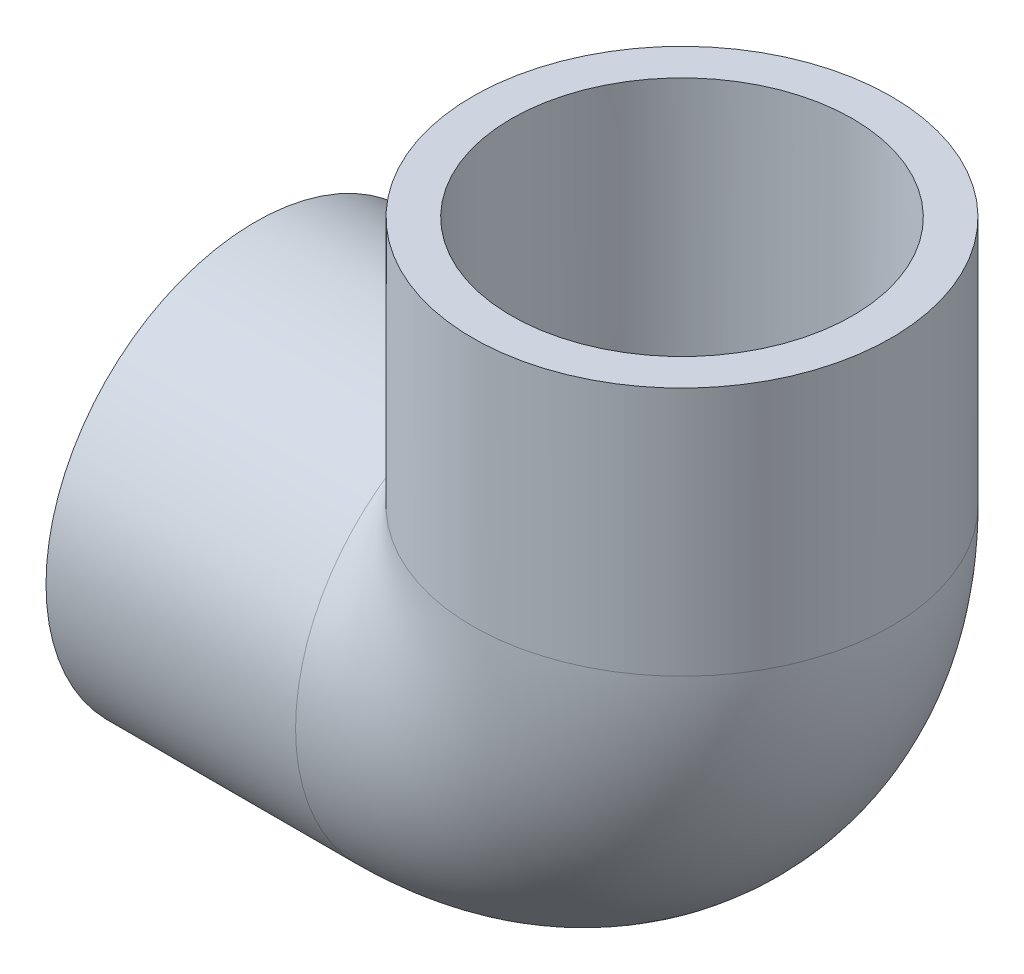
from build123d import *

# Parameters (mm, degrees)
SKETCH3_R   = 20.6375
SKETCH3_R_2 = 13.3223


with BuildPart() as part:
    # Sketch1 → Revolve1 (revolve)
    with BuildSketch(Plane.XY):
        Polygon((-42.06875, -20.6375), (-17.4625, -20.6375), (-17.4625, -16.637), (-42.06875, -16.8275), align=None)
    revolve(axis=Axis((-42.06875, 0, 0), (1, 0, 0)))


with BuildPart() as body_2:
    # Sketch2 → Revolve2 (revolve)
    with BuildSketch(Plane.XY):
        Polygon((16.8275, 42.06875), (16.637, 17.4625), (20.6375, 17.4625), (20.6375, 42.06875), align=None)
    revolve(axis=Axis((0, 0, 0), (0, 1, 0)))


with BuildPart() as sweep1_tool:
    # Sweep1: sweep along a path in Sketch4
    with BuildLine(Plane.XY) as sweep1_path:
        ThreePointArc((-17.4625, 0), (-5.114648, 5.114648), (0, 17.4625))
    # Sketch3 → Sweep1 (sweep)
    with BuildSketch(Plane(origin=(-17.4625, 0, 0), x_dir=(0, 0, -1), z_dir=(1, 0, 0))):
        Circle(SKETCH3_R)
        Circle(SKETCH3_R_2, mode=Mode.SUBTRACT)
    sweep(path=sweep1_path.line)


with BuildPart() as part_1:
    add(part.part)


with BuildPart() as part_2:
    # Sweep1: joined with sweep1_tool
    add(part_1.part.fuse(sweep1_tool.part, body_2.part, tol=0.00001))


solid = part_2.part
